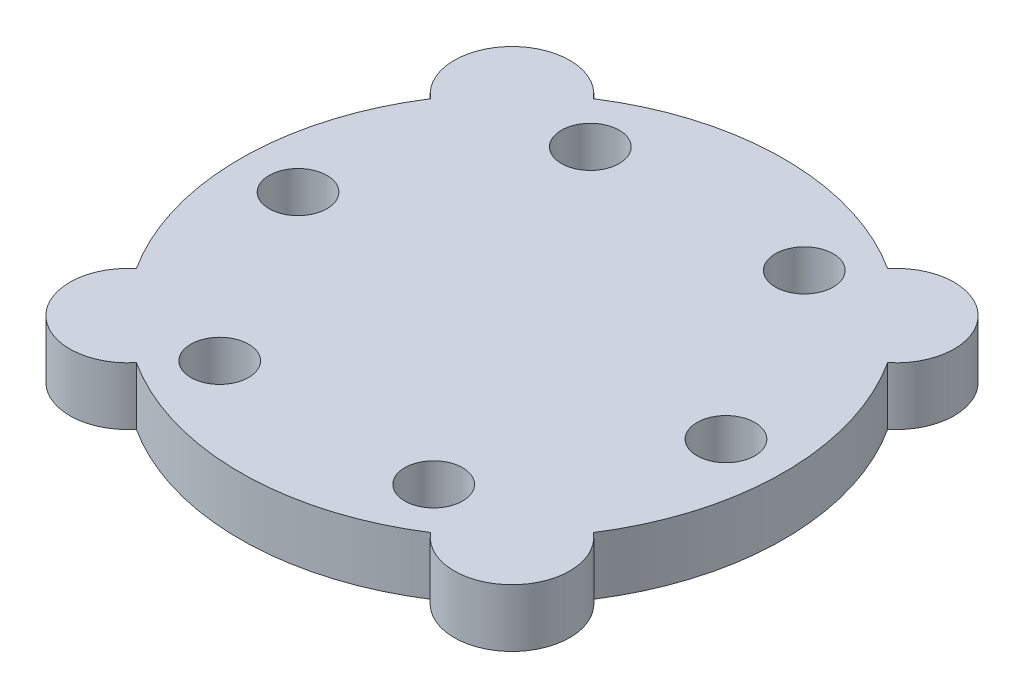
from build123d import *

# Parameters (mm, degrees)
BOSS_EXTRUDE1_DEPTH = 0.25
CUT_EXTRUDE1_REACH  = 5.361
SKETCH2_R           = 0.25


with BuildPart() as part:
    # Sketch1 → Boss-Extrude1 (new, symmetric)
    with BuildSketch(Plane(origin=(0, 0, 0), x_dir=(1, 0, 0), z_dir=(0, 1, 0))):
        with BuildLine():
            ThreePointArc((-1.975635929, 1.272541817), (-2.35, 0), (-1.975635929, -1.272541817))
            ThreePointArc((-1.975635929, -1.272541817), (-2.015254326, -2.015254326), (-1.272541817, -1.975635929))
            ThreePointArc((-1.272541817, -1.975635929), (0, -2.35), (1.272541817, -1.975635929))
            ThreePointArc((1.272541817, -1.975635929), (2.015254326, -2.015254326), (1.975635929, -1.272541817))
            ThreePointArc((1.975635929, -1.272541817), (2.35, 0), (1.975635929, 1.272541817))
            ThreePointArc((1.975635929, 1.272541817), (2.015254326, 2.015254326), (1.272541817, 1.975635929))
            ThreePointArc((1.272541817, 1.975635929), (0, 2.35), (-1.272541817, 1.975635929))
            ThreePointArc((-1.272541817, 1.975635929), (-2.015254326, 2.015254326), (-1.975635929, 1.272541817))
        make_face()
    extrude(amount=BOSS_EXTRUDE1_DEPTH, both=True)

    # Sketch2 → Cut-Extrude1 (cut, up to next)
    with BuildSketch(Plane(origin=(0, 0.25, 0), x_dir=(1, 0, 0), z_dir=(0, 1, 0)), mode=Mode.PRIVATE) as cut_extrude1_sk1:
        with Locations((-1.85, 0)):
            Circle(SKETCH2_R)
    cut_extrude1_tool1 = extrude(cut_extrude1_sk1.sketch, amount=-CUT_EXTRUDE1_REACH, mode=Mode.PRIVATE) & part.part
    # Sketch2 → Cut-Extrude1 (cut, up to next)
    with BuildSketch(Plane(origin=(0, 0.25, 0), x_dir=(1, 0, 0), z_dir=(0, 1, 0)), mode=Mode.PRIVATE) as cut_extrude1_sk2:
        with Locations((-0.925, 1.602146997)):
            Circle(SKETCH2_R)
    cut_extrude1_tool2 = extrude(cut_extrude1_sk2.sketch, amount=-CUT_EXTRUDE1_REACH, mode=Mode.PRIVATE) & part.part
    # Sketch2 → Cut-Extrude1 (cut, up to next)
    with BuildSketch(Plane(origin=(0, 0.25, 0), x_dir=(1, 0, 0), z_dir=(0, 1, 0)), mode=Mode.PRIVATE) as cut_extrude1_sk3:
        with Locations((0.925, 1.602146997)):
            Circle(SKETCH2_R)
    cut_extrude1_tool3 = extrude(cut_extrude1_sk3.sketch, amount=-CUT_EXTRUDE1_REACH, mode=Mode.PRIVATE) & part.part
    # Sketch2 → Cut-Extrude1 (cut, up to next)
    with BuildSketch(Plane(origin=(0, 0.25, 0), x_dir=(1, 0, 0), z_dir=(0, 1, 0)), mode=Mode.PRIVATE) as cut_extrude1_sk4:
        with Locations((1.85, 0)):
            Circle(SKETCH2_R)
    cut_extrude1_tool4 = extrude(cut_extrude1_sk4.sketch, amount=-CUT_EXTRUDE1_REACH, mode=Mode.PRIVATE) & part.part
    # Sketch2 → Cut-Extrude1 (cut, up to next)
    with BuildSketch(Plane(origin=(0, 0.25, 0), x_dir=(1, 0, 0), z_dir=(0, 1, 0)), mode=Mode.PRIVATE) as cut_extrude1_sk5:
        with Locations((0.925, -1.602146997)):
            Circle(SKETCH2_R)
    cut_extrude1_tool5 = extrude(cut_extrude1_sk5.sketch, amount=-CUT_EXTRUDE1_REACH, mode=Mode.PRIVATE) & part.part
    # Sketch2 → Cut-Extrude1 (cut, up to next)
    with BuildSketch(Plane(origin=(0, 0.25, 0), x_dir=(1, 0, 0), z_dir=(0, 1, 0)), mode=Mode.PRIVATE) as cut_extrude1_sk6:
        with Locations((-0.925, -1.602146997)):
            Circle(SKETCH2_R)
    cut_extrude1_tool6 = extrude(cut_extrude1_sk6.sketch, amount=-CUT_EXTRUDE1_REACH, mode=Mode.PRIVATE) & part.part
    add(cut_extrude1_tool1.solids().sort_by_distance((-1.85, 0.25, 0))[0], mode=Mode.SUBTRACT)
    add(cut_extrude1_tool2.solids().sort_by_distance((-0.925, 0.25, -1.602147))[0], mode=Mode.SUBTRACT)
    add(cut_extrude1_tool3.solids().sort_by_distance((0.925, 0.25, -1.602147))[0], mode=Mode.SUBTRACT)
    add(cut_extrude1_tool4.solids().sort_by_distance((1.85, 0.25, 0))[0], mode=Mode.SUBTRACT)
    add(cut_extrude1_tool5.solids().sort_by_distance((0.925, 0.25, 1.602147))[0], mode=Mode.SUBTRACT)
    add(cut_extrude1_tool6.solids().sort_by_distance((-0.925, 0.25, 1.602147))[0], mode=Mode.SUBTRACT)


solid = part.part
